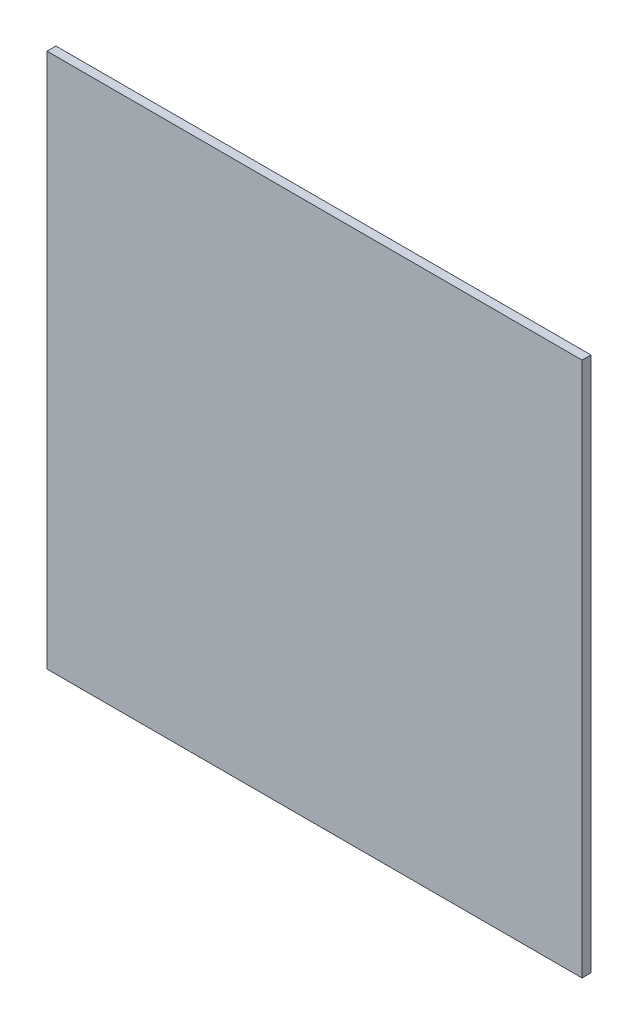
from build123d import *

# Parameters (mm, degrees)
SKETCH1_W           = 120000
SKETCH1_H           = 120000
BOSS_EXTRUDE1_DEPTH = 2000


with BuildPart() as part:
    # Sketch1 → Boss-Extrude1 (new body)
    with BuildSketch(Plane.XY):
        with Locations((60000, 60000)):
            Rectangle(SKETCH1_W, SKETCH1_H)
    extrude(amount=BOSS_EXTRUDE1_DEPTH)


solid = part.part
